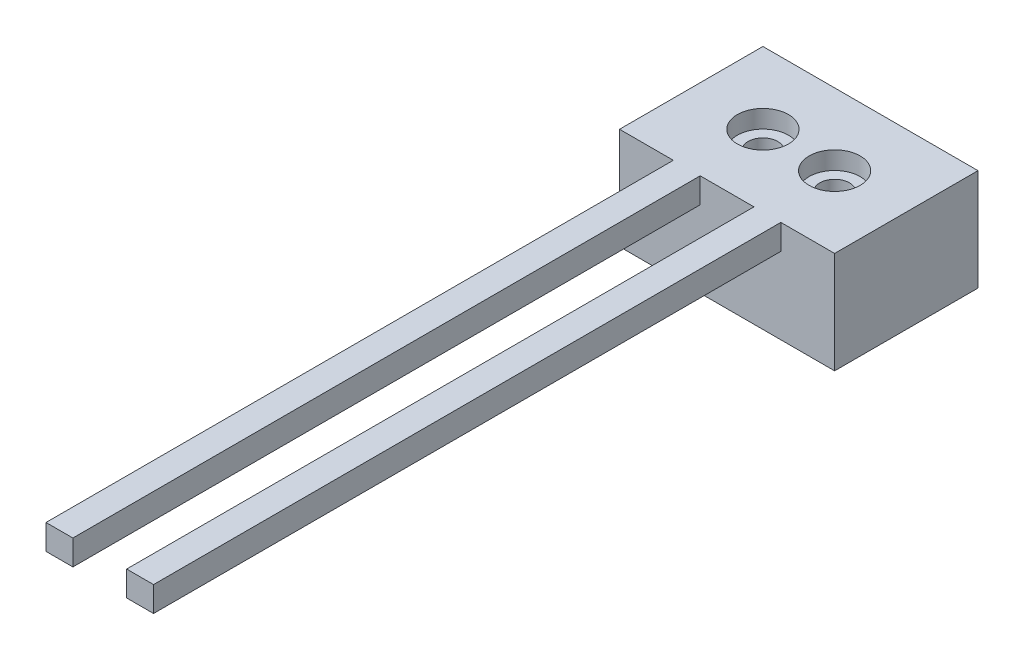
from build123d import *

# Parameters (mm, degrees)
SKETCH1_W           = 24
SKETCH1_H           = 16
SKETCH1_R           = 1.65
BOSS_EXTRUDE1_DEPTH = 11.35
SKETCH2_W           = 3
SKETCH2_H           = 2.8
BOSS_EXTRUDE2_DEPTH = 70
SKETCH3_R           = 2.85
CUT_EXTRUDE1_DEPTH  = 2


with BuildPart() as part:
    # Sketch1 → Boss-Extrude1 (new body)
    with BuildSketch(Plane.XZ):
        with Locations((12, -8)):
            Rectangle(SKETCH1_W, SKETCH1_H)
        with Locations((8, -8)):
            Circle(SKETCH1_R, mode=Mode.SUBTRACT)
        with Locations((16, -8)):
            Circle(SKETCH1_R, mode=Mode.SUBTRACT)
    extrude(amount=BOSS_EXTRUDE1_DEPTH)

    # Sketch2 → Boss-Extrude2 (add)
    with BuildSketch(Plane.XY):
        with Locations((7.5, -1.4)):
            Rectangle(SKETCH2_W, SKETCH2_H)
        with Locations((16.5, -1.4)):
            Rectangle(SKETCH2_W, SKETCH2_H)
    extrude(amount=BOSS_EXTRUDE2_DEPTH)

    # Sketch3 → Cut-Extrude1 (cut)
    with BuildSketch(Plane(origin=(0, 0, 0), x_dir=(1, 0, 0), z_dir=(0, 1, 0))):
        with Locations((8, 8)):
            Circle(SKETCH3_R)
        with Locations((16, 8)):
            Circle(SKETCH3_R)
    extrude(amount=-CUT_EXTRUDE1_DEPTH, mode=Mode.SUBTRACT)


solid = part.part
